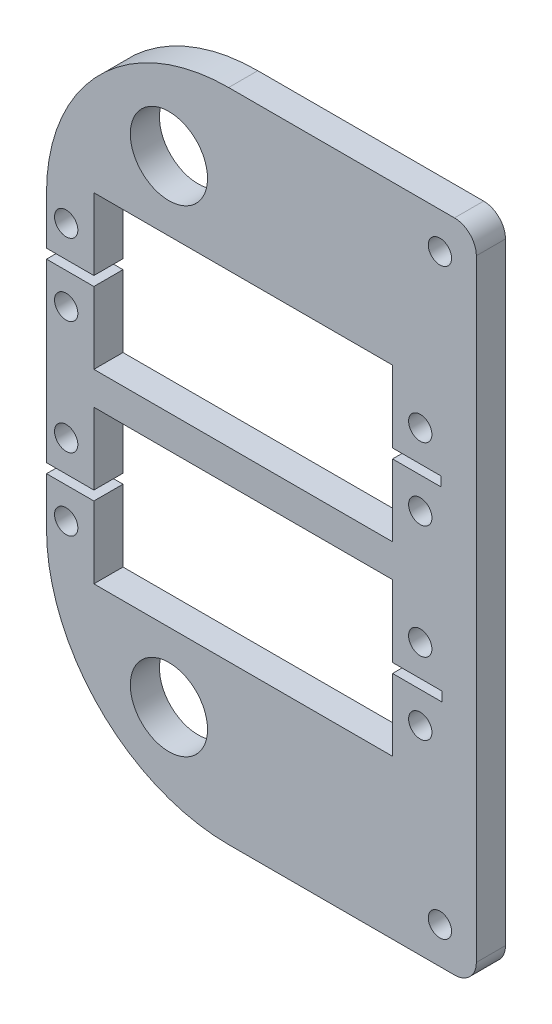
from build123d import *

# Parameters (mm, degrees)
SKETCH_1_W          = 59
SKETCH_1_H          = 90
SKETCH_1_W_2        = 41
SKETCH_1_H_2        = 21
EXTRUDE_1_DEPTH     = 4
SKETCH_2_R          = 1.6
SKETCH_2_W          = 6.8
SKETCH_2_H          = 1.3
SKETCH_2_W_2        = 6.65
CUT_EXTRUDE_1_DEPTH = 4
SKETCH_3_R          = 5.3
CUT_EXTRUDE_2_DEPTH = 4
FILLET_1_R          = 25
FILLET_2_R          = 3
SKETCH_4_R          = 1.6
CUT_EXTRUDE_3_DEPTH = 10


with BuildPart() as part:
    # ｽｹｯﾁ1 → ﾎﾞｽ - 押し出し1 (new body)
    with BuildSketch(Plane.XY):
        with Locations((2.5, 12.75)):
            Rectangle(SKETCH_1_W, SKETCH_1_H)
        Rectangle(SKETCH_1_W_2, SKETCH_1_H_2, mode=Mode.SUBTRACT)
        with Locations((0, 25.5)):
            Rectangle(SKETCH_1_W_2, SKETCH_1_H_2, mode=Mode.SUBTRACT)
    extrude(amount=EXTRUDE_1_DEPTH)

    # ｽｹｯﾁ2 → ｶｯﾄ - 押し出し1 (cut)
    with BuildSketch(Plane(origin=(0, 0, 0), x_dir=(-1, 0, 0), z_dir=(0, 0, -1))):
        with Locations((-24.3, -4.95)):
            Circle(SKETCH_2_R)
        with Locations((-24.3, 4.95)):
            Circle(SKETCH_2_R)
        with Locations((-24.3, 20.55)):
            Circle(SKETCH_2_R)
        with Locations((-24.3, 30.45)):
            Circle(SKETCH_2_R)
        with Locations((24.3, 30.45)):
            Circle(SKETCH_2_R)
        with Locations((24.3, 20.55)):
            Circle(SKETCH_2_R)
        with Locations((24.3, 4.95)):
            Circle(SKETCH_2_R)
        with Locations((24.3, -4.95)):
            Circle(SKETCH_2_R)
        with Locations((-23.9, 0)):
            Rectangle(SKETCH_2_W, SKETCH_2_H)
        with Locations((-23.825, 25.5)):
            Rectangle(SKETCH_2_W_2, SKETCH_2_H)
        with Locations((23.825, 25.5)):
            Rectangle(SKETCH_2_W_2, SKETCH_2_H)
        with Locations((23.825, 0)):
            Rectangle(SKETCH_2_W_2, SKETCH_2_H)
    extrude(amount=-CUT_EXTRUDE_1_DEPTH, mode=Mode.SUBTRACT)

    # ｽｹｯﾁ3 → ｶｯﾄ - 押し出し2 (cut)
    with BuildSketch(Plane.XY.offset(4)):
        with Locations((-10.2, 45.5)):
            Circle(SKETCH_3_R)
        with Locations((-10.2, -20)):
            Circle(SKETCH_3_R)
    extrude(amount=-CUT_EXTRUDE_2_DEPTH, mode=Mode.SUBTRACT)

    # ﾌｨﾚｯﾄ1
    fillet_1_edges = [part.edges().sort_by_distance(p)[0] for p in [
        (-27, -32.25, 2),
        (-27, 57.75, 2),
    ]]
    fillet(fillet_1_edges, radius=FILLET_1_R)

    # ﾌｨﾚｯﾄ2
    fillet_2_edges = [part.edges().sort_by_distance(p)[0] for p in [
        (32, -32.25, 2),
        (32, 57.75, 2),
    ]]
    fillet(fillet_2_edges, radius=FILLET_2_R)

    # ｽｹｯﾁ4 → ｶｯﾄ - 押し出し3 (cut)
    with BuildSketch(Plane.XY.offset(4)):
        with Locations((27, 52.75)):
            Circle(SKETCH_4_R)
        with Locations((27, -27.25)):
            Circle(SKETCH_4_R)
    extrude(amount=-CUT_EXTRUDE_3_DEPTH, mode=Mode.SUBTRACT)


solid = part.part
